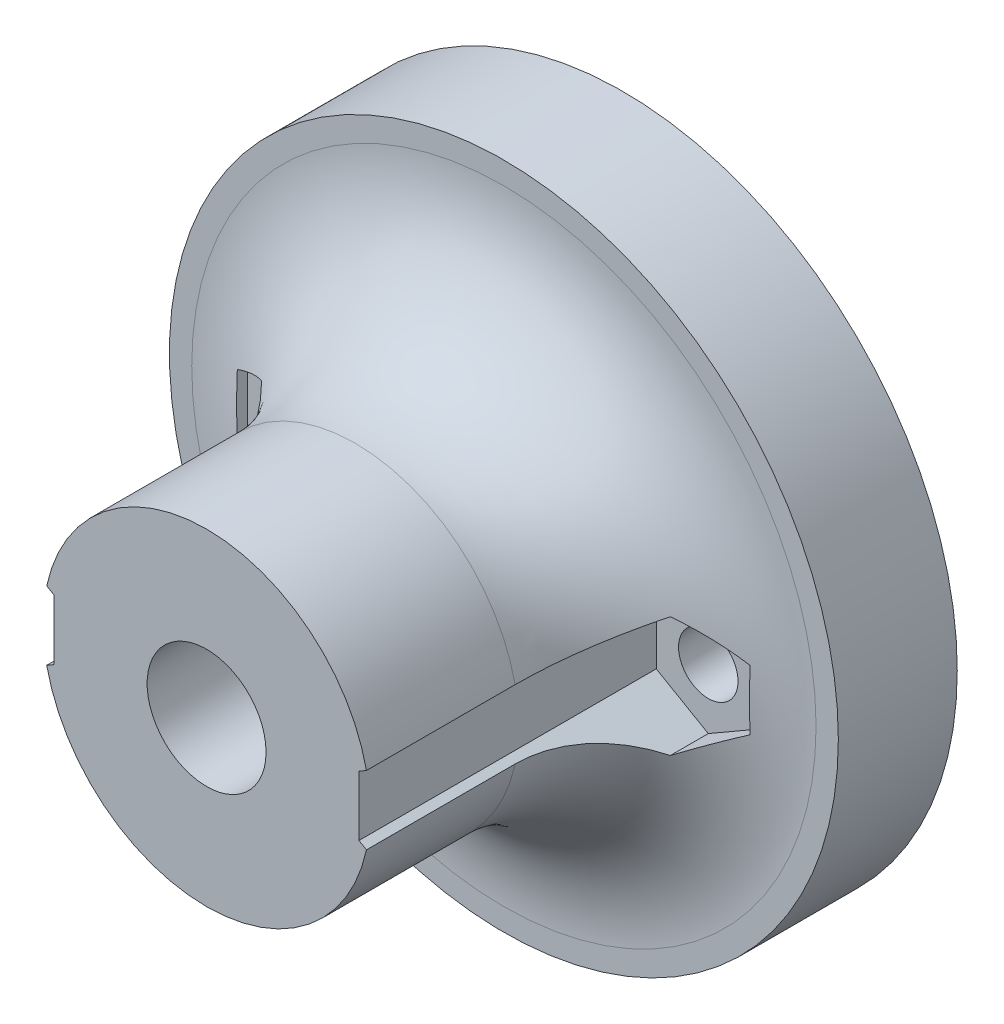
from build123d import *

# Parameters (mm, degrees)
SKETCH1_R           = 22.5
SKETCH1_R_2         = 2
BOSS_EXTRUDE1_DEPTH = 8
SKETCH2_R           = 11
SKETCH2_R_2         = 4
BOSS_EXTRUDE2_DEPTH = 20
FILLET1_R           = 10
CUT_EXTRUDE1_START  = -8
CUT_EXTRUDE1_DEPTH  = 35.385138905


with BuildPart() as part:
    # Sketch1 → Boss-Extrude1 (new body)
    with BuildSketch(Plane.XY):
        Circle(SKETCH1_R)
        with Locations((-13.75, 0)):
            Circle(SKETCH1_R_2, mode=Mode.SUBTRACT)
        with Locations((13.75, 0)):
            Circle(SKETCH1_R_2, mode=Mode.SUBTRACT)
        Polygon((0, 9.814954576), (-8.5, 4.907477288), (-8.5, -4.907477288), (0, -9.814954576), (8.5, -4.907477288), (8.5, 4.907477288), align=None, mode=Mode.SUBTRACT)
    extrude(amount=BOSS_EXTRUDE1_DEPTH)

    # Sketch2 → Boss-Extrude2 (add)
    with BuildSketch(Plane.XY.offset(8)):
        Circle(SKETCH2_R)
        Circle(SKETCH2_R_2, mode=Mode.SUBTRACT)
    extrude(amount=BOSS_EXTRUDE2_DEPTH)

    # Fillet1
    # the kernel refuses this fillet: 10 mm, written as the material it adds along each edge
    with BuildSketch(Plane(origin=(0, 0, 8), x_dir=(1, 0, 0), z_dir=(0, -1, 0))) as fillet1_piece_1_section:
        with BuildLine():
            CenterArc((11 + FILLET1_R, FILLET1_R), FILLET1_R, 180, 90)
            Line((11, FILLET1_R), (11, 0))
            Line((11, 0), (11 + FILLET1_R, 0))
        make_face()
    fillet1_piece_1 = revolve(axis=Axis((0, 0, 8), (0, 0, 1)), mode=Mode.PRIVATE)
    fillet1_piece_1 = fillet1_piece_1 - Plane(origin=(-13.75, 0, 8.218261163), x_dir=(1, 0, 0), z_dir=(0, 0, -1)) * Cylinder(2, 84, mode=Mode.PRIVATE)
    fillet1_piece_1 = fillet1_piece_1 - Plane(origin=(13.75, 0, 8.218261163), x_dir=(1, 0, 0), z_dir=(0, 0, -1)) * Cylinder(2, 84, mode=Mode.PRIVATE)
    add(fillet1_piece_1)

    # Sketch3 → Cut-Extrude1 (cut, through all)
    with BuildSketch(Plane(origin=(0, 0, 0), x_dir=(-1, 0, 0), z_dir=(0, 0, -1)).offset(CUT_EXTRUDE1_START)):
        Polygon((-13.75, 4.041451884), (-17.25, 2.020725942), (-17.25, -2.020725942), (-13.75, -4.041451884), (-10.25, -2.020725942), (-10.25, 2.020725942), align=None)
        Polygon((13.75, 4.041451884), (10.25, 2.020725942), (10.25, -2.020725942), (13.75, -4.041451884), (17.25, -2.020725942), (17.25, 2.020725942), align=None)
    extrude(amount=-CUT_EXTRUDE1_DEPTH, mode=Mode.SUBTRACT)


solid = part.part
